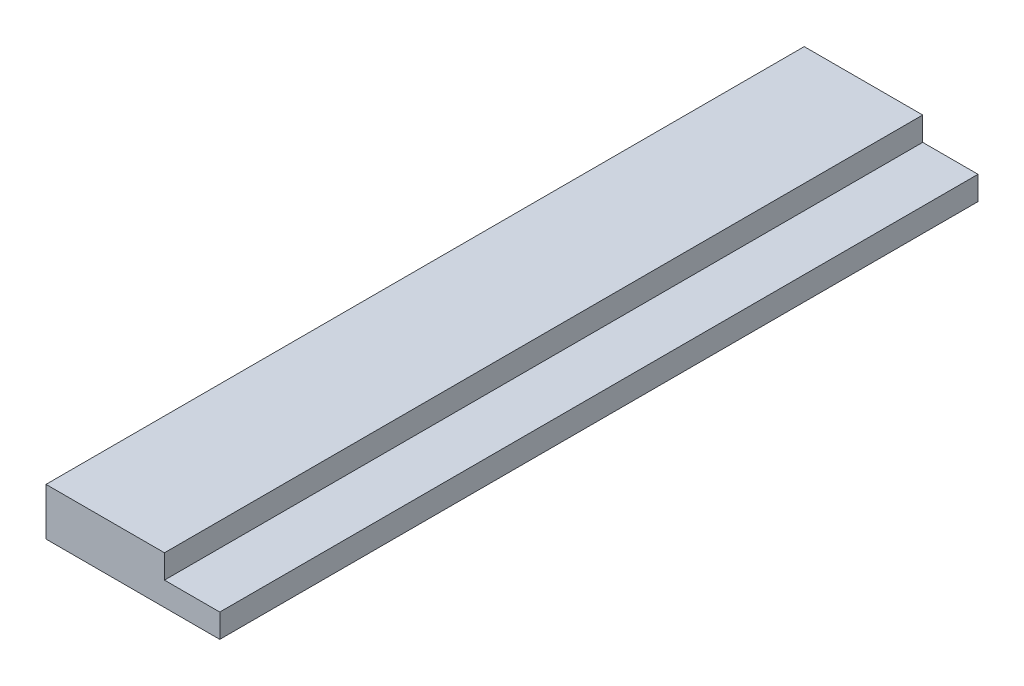
from build123d import *

# Parameters (mm, degrees)
BOSS_EXTRUDE1_DEPTH      = 304.8
BOSS_EXTRUDE1_DEPTH_BACK = 304.8
SKETCH1_W                = 139.7
SKETCH1_H                = 38.1
SKETCH2_W                = 44.45
SKETCH2_H                = 19.05
CUT_EXTRUDE1_DEPTH       = 614.884423161


with BuildPart() as part:
    # Sketch1 → Boss-Extrude1 (new, two sides: drawn at the far end of the back side and taken through both)
    with BuildSketch(Plane.XY.offset(-BOSS_EXTRUDE1_DEPTH_BACK)):
        Rectangle(SKETCH1_W, SKETCH1_H)
    extrude(amount=BOSS_EXTRUDE1_DEPTH + BOSS_EXTRUDE1_DEPTH_BACK)

    # Sketch2 → Cut-Extrude1 (cut, through all)
    with BuildSketch(Plane.XY.offset(304.8)):
        with Locations((47.625, 9.525)):
            Rectangle(SKETCH2_W, SKETCH2_H)
    extrude(amount=-CUT_EXTRUDE1_DEPTH, mode=Mode.SUBTRACT)


solid = part.part
